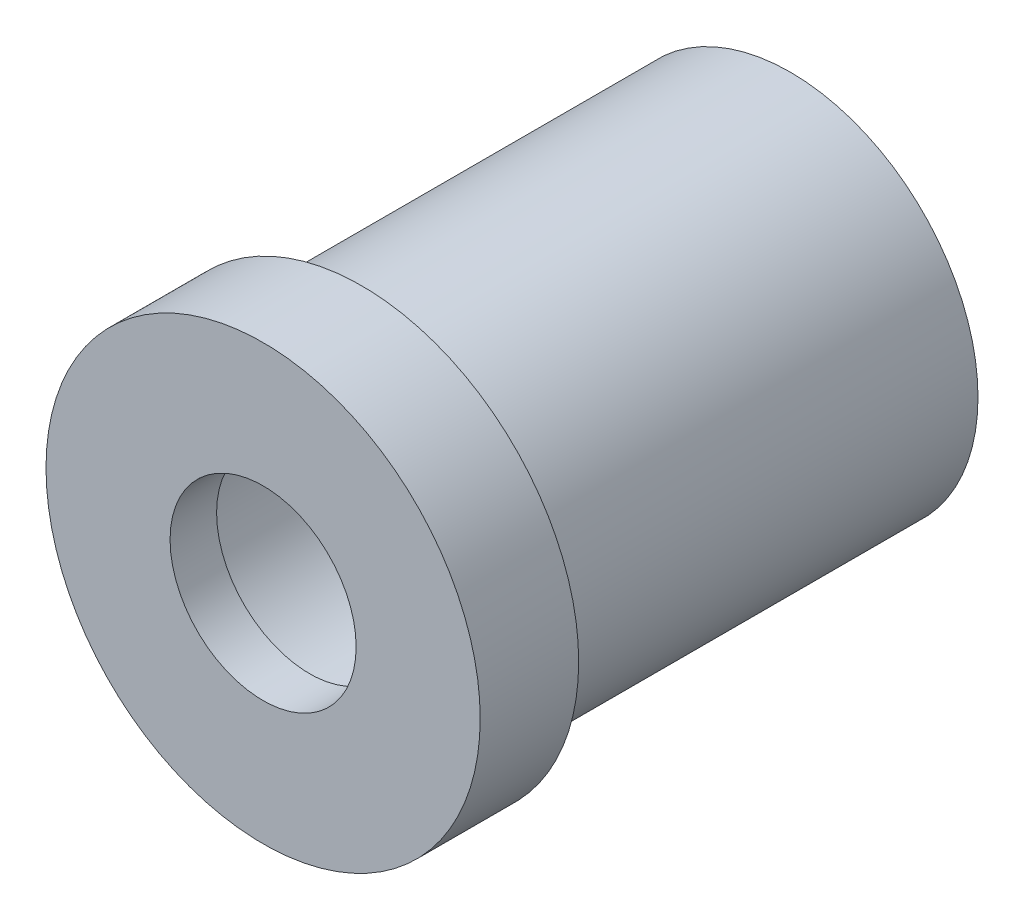
from build123d import *

# Parameters (mm, degrees)
SKETCH1_R           = 12.1
BOSS_EXTRUDE1_DEPTH = 17
SKETCH2_R           = 7.7
CUT_EXTRUDE1_DEPTH  = 39.063368217
SKETCH3_R           = 14
SKETCH3_R_2         = 12.1
BOSS_EXTRUDE2_DEPTH = 6.35
SKETCH4_R           = 7.7
SKETCH4_R_2         = 6
BOSS_EXTRUDE3_DEPTH = 3


with BuildPart() as part:
    # Sketch1 → Boss-Extrude1 (new, symmetric)
    with BuildSketch(Plane.XY):
        Circle(SKETCH1_R)
    extrude(amount=BOSS_EXTRUDE1_DEPTH, both=True)

    # Sketch2 → Cut-Extrude1 (cut, through all)
    with BuildSketch(Plane.XY.offset(17)):
        Circle(SKETCH2_R)
    extrude(amount=-CUT_EXTRUDE1_DEPTH, mode=Mode.SUBTRACT)

    # Sketch3 → Boss-Extrude2 (add)
    with BuildSketch(Plane.XY.offset(17)):
        Circle(SKETCH3_R)
        Circle(SKETCH3_R_2, mode=Mode.SUBTRACT)
    extrude(amount=-BOSS_EXTRUDE2_DEPTH)

    # Sketch4 → Boss-Extrude3 (add)
    with BuildSketch(Plane.XY.offset(17)):
        Circle(SKETCH4_R)
        Circle(SKETCH4_R_2, mode=Mode.SUBTRACT)
    extrude(amount=-BOSS_EXTRUDE3_DEPTH)


solid = part.part
